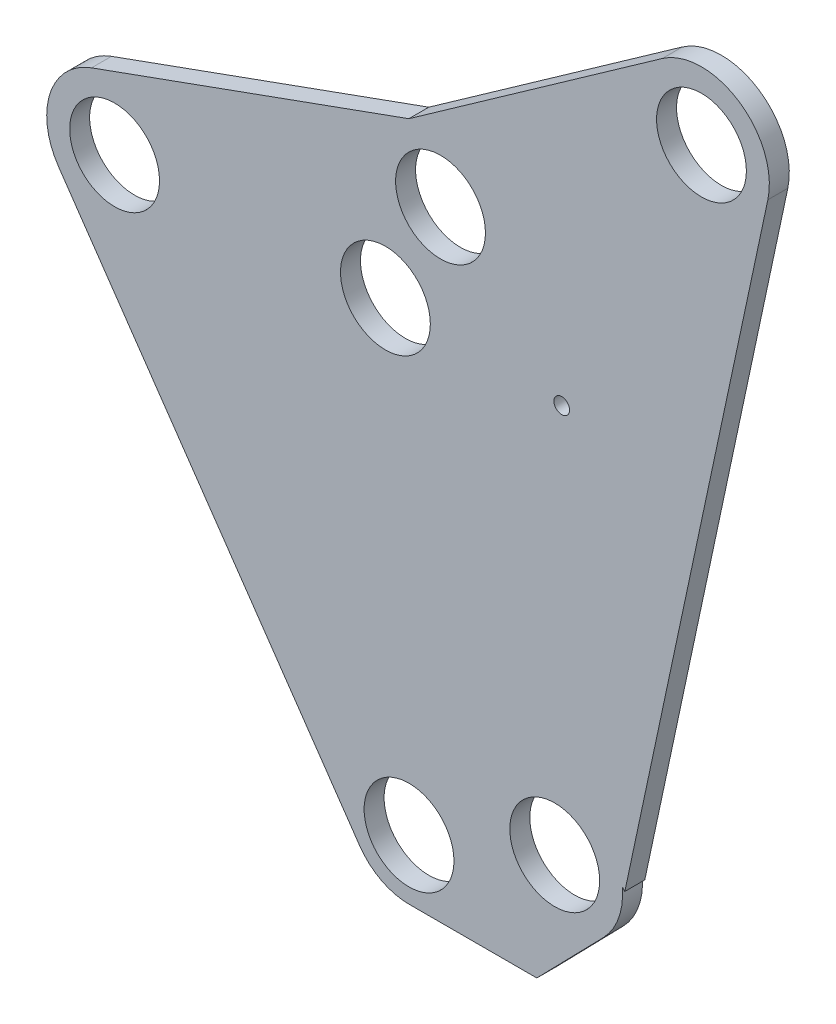
from build123d import *

# Parameters (mm, degrees)
SKETCH38_S_25_GCI_S_0001_2_R   = 14.2875
SKETCH38_S_25_GCI_S_0001_2_R_2 = 2.4892
BOSS_EXTRUDE1_DEPTH            = 6.35


with BuildPart() as part:
    # Sketch38-S-25-GCI-S-0001<2> → Boss-Extrude1 (new body)
    with BuildSketch(Plane.XY):
        with BuildLine():
            Line((-267.582641172, 151.228945871), (-171.823955284, 12.10881585))
            ThreePointArc((-171.823955284, 12.10881585), (-164.995970804, 6.047757657), (-156.131940744, 3.85988893))
            Line((-156.131940744, 3.85988893), (-115.491940744, 3.85988893))
            Line((-115.491940744, 3.85988893), (-94.327391062, 25.578857548))
            ThreePointArc((-94.327391062, 25.578857548), (-89.445544862, 33.419278976), (-88.28685593, 42.582360905))
            Line((-88.28685593, 42.582360905), (-87.487452782, 41.709869875))
            Line((-87.487452782, 41.709869875), (-41.993345158, 254.997736587))
            ThreePointArc((-41.993345158, 254.997736587), (-51.218924254, 277.522910932), (-75.557146319, 277.141157582))
            Line((-75.557146319, 277.141157582), (-156.189588135, 220.236480432))
            Line((-156.189588135, 220.236480432), (-257.132811081, 183.776168489))
            ThreePointArc((-257.132811081, 183.776168489), (-270.354820565, 170.070158081), (-267.582641172, 151.228945871))
        make_face()
        with Locations((-163.647441506, 167.09094488)):
            Circle(SKETCH38_S_25_GCI_S_0001_2_R, mode=Mode.SUBTRACT)
        with Locations((-146.118277979, 200.919016449)):
            Circle(SKETCH38_S_25_GCI_S_0001_2_R, mode=Mode.SUBTRACT)
        with Locations((-249.798358026, 163.470162029)):
            Circle(SKETCH38_S_25_GCI_S_0001_2_R, mode=Mode.SUBTRACT)
        with Locations((-63.108358026, 259.501549592)):
            Circle(SKETCH38_S_25_GCI_S_0001_2_R, mode=Mode.SUBTRACT)
        with Locations((-109.78990616, 40.646661861)):
            Circle(SKETCH38_S_25_GCI_S_0001_2_R, mode=Mode.SUBTRACT)
        with Locations((-156.131940744, 22.90988893)):
            Circle(SKETCH38_S_25_GCI_S_0001_2_R, mode=Mode.SUBTRACT)
        with Locations((-107.558358026, 165.521549592)):
            Circle(SKETCH38_S_25_GCI_S_0001_2_R_2, mode=Mode.SUBTRACT)
    extrude(amount=BOSS_EXTRUDE1_DEPTH)


solid = part.part
